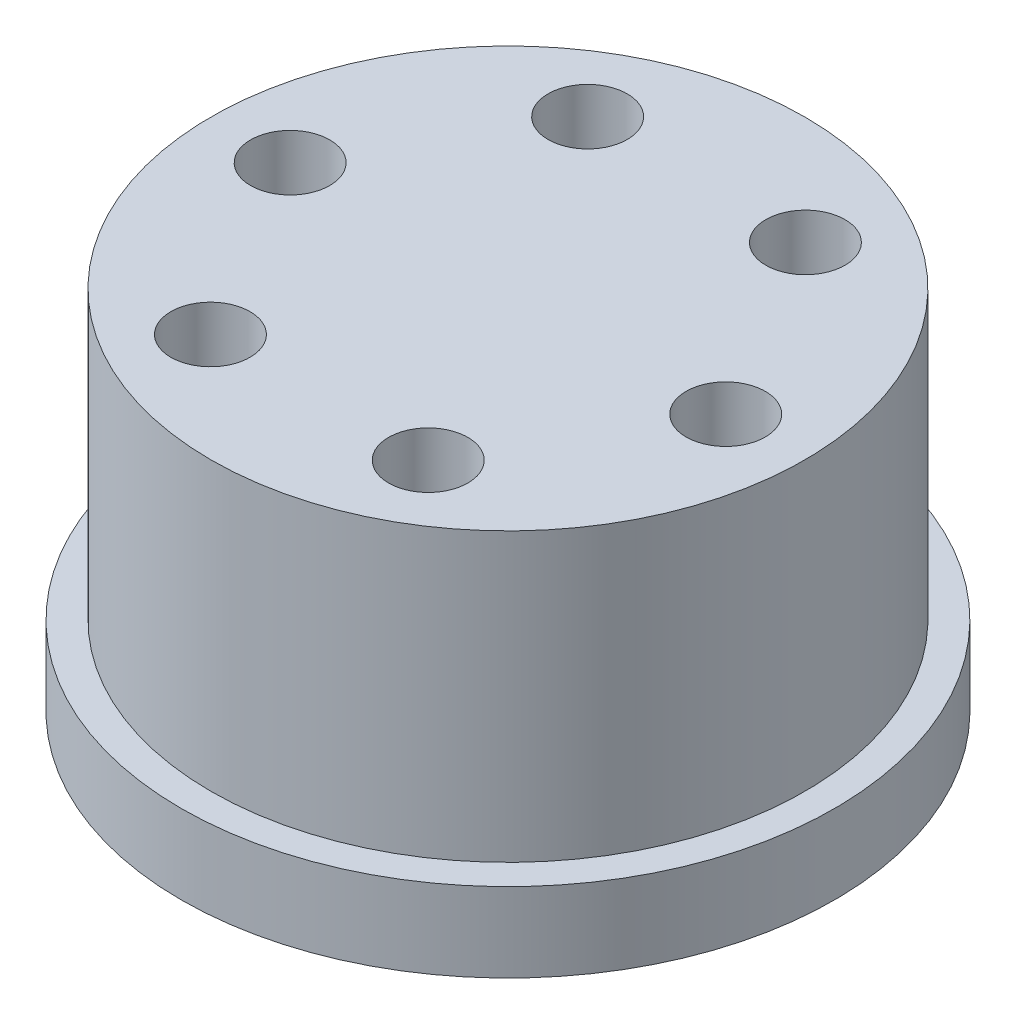
from build123d import *

# Parameters (mm, degrees)
SKETCH1_R           = 16.5
SKETCH1_R_2         = 1.75
BOSS_EXTRUDE1_DEPTH = 4
SKETCH2_R           = 15
BOSS_EXTRUDE2_DEPTH = 14.5
SKETCH5_R           = 2
CUT_EXTRUDE3_DEPTH  = 6.5
SKETCH6_R           = 7.6
CUT_EXTRUDE4_DEPTH  = 5


with BuildPart() as part:
    # Sketch1 → Boss-Extrude1 (new body)
    with BuildSketch(Plane(origin=(0, 0, 0), x_dir=(1, 0, 0), z_dir=(0, 1, 0))):
        Circle(SKETCH1_R)
        with Locations((0, 12.5)):
            Circle(SKETCH1_R_2, mode=Mode.SUBTRACT)
        with Locations((10.825317547, 6.25)):
            Circle(SKETCH1_R_2, mode=Mode.SUBTRACT)
        with Locations((10.825317547, -6.25)):
            Circle(SKETCH1_R_2, mode=Mode.SUBTRACT)
        with Locations((0, -12.5)):
            Circle(SKETCH1_R_2, mode=Mode.SUBTRACT)
        with Locations((-10.825317547, -6.25)):
            Circle(SKETCH1_R_2, mode=Mode.SUBTRACT)
        with Locations((-10.825317547, 6.25)):
            Circle(SKETCH1_R_2, mode=Mode.SUBTRACT)
    extrude(amount=BOSS_EXTRUDE1_DEPTH)

    # Sketch2 → Boss-Extrude2 (add)
    with BuildSketch(Plane(origin=(0, 4, 0), x_dir=(1, 0, 0), z_dir=(0, 1, 0))):
        Circle(SKETCH2_R)
    extrude(amount=BOSS_EXTRUDE2_DEPTH)

    # Sketch5 → Cut-Extrude3 (cut)
    with BuildSketch(Plane(origin=(0, 18.5, 0), x_dir=(1, 0, 0), z_dir=(0, 1, 0))):
        with Locations((-11, 0)):
            Circle(SKETCH5_R)
        with Locations((-5.5, 9.526279442)):
            Circle(SKETCH5_R)
        with Locations((5.5, 9.526279442)):
            Circle(SKETCH5_R)
        with Locations((11, 0)):
            Circle(SKETCH5_R)
        with Locations((5.5, -9.526279442)):
            Circle(SKETCH5_R)
        with Locations((-5.5, -9.526279442)):
            Circle(SKETCH5_R)
    extrude(amount=-CUT_EXTRUDE3_DEPTH, mode=Mode.SUBTRACT)

    # Sketch6 → Cut-Extrude4 (cut)
    with BuildSketch(Plane.XZ):
        Circle(SKETCH6_R)
    extrude(amount=-CUT_EXTRUDE4_DEPTH, mode=Mode.SUBTRACT)


solid = part.part
